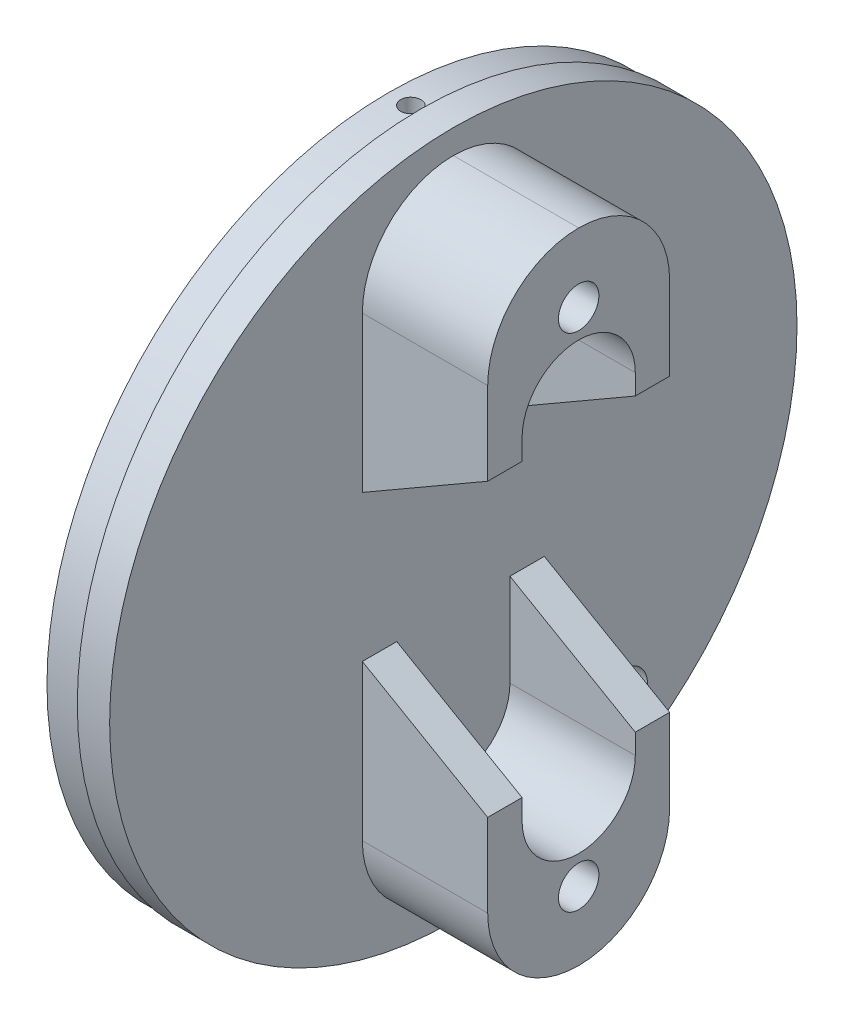
from build123d import *

# Parameters (mm, degrees)
ESQUISSE1_W                         = 32.5
ESQUISSE1_H                         = 42.5
ESQUISSE2_W                         = 9
ESQUISSE2_H                         = 58.5
CONG_R2_R                           = 2
ESQUISSE3_W                         = 4
ESQUISSE3_H                         = 0.25
D_GROSSISEMENT_OUTLINE_R            = 42.5
D_GROSSISEMENT_OUTLINE_W            = 22.5
D_GROSSISEMENT_OUTLINE_H            = 79
D_GROSSISEMENT_DEPTH                = 15.5
FINITION_EXT_R                      = 11.25
USINAGE_EN_V_DEPTH                  = 63.461988441
USINAGE_EN_V_DEPTH_BACK             = 63.461988441
RAINURE_INT_DEPTH                   = 63.461988441
ESQUISSE10_W                        = 2.5
ESQUISSE10_H                        = 15.5
TROU_TARAUD_M61_AT_2_COUNT          = 2
TROU_TARAUD_M61_AT_2_PITCH          = 62
TROU_TARAUD_M41_D                   = 3.3
DIAM_TRE_DU_PER_AGE_6_0_6_1_D       = 6
DIAM_TRE_DU_PER_AGE_2_5_2_5_1_D     = 2.5
DIAM_TRE_DU_PER_AGE_2_5_2_5_1_DEPTH = 3
DIAM_TRE_DU_PER_AGE_2_5_2_5_1_TIP   = 0.751075774


# Read off the part's stored shape, not the designer's step: Dégrossisement
with BuildPart() as part:
    # Esquisse1 → Brut (revolve)
    with BuildSketch(Plane.XY, mode=Mode.PRIVATE) as brut_sk:
        with Locations((-0.75, 21.25)):
            Rectangle(ESQUISSE1_W, ESQUISSE1_H)
    revolve(brut_sk.sketch.rotate(Axis((-714.885574261, 0, 0), (1, 0, 0)), 90), axis=Axis((-714.885574261, 0, 0), (1, 0, 0)))

    # Esquisse2 → Pion désaxer (revolve, cut)
    with BuildSketch(Plane.XY, mode=Mode.PRIVATE) as pion_d_saxer_sk:
        with Locations((-12.5, -13.25)):
            Rectangle(ESQUISSE2_W, ESQUISSE2_H)
    revolve(pion_d_saxer_sk.sketch.rotate(Axis((-1017, 20.5, 0), (1, 0, 0)), 270), axis=Axis((-1017, 20.5, 0), (1, 0, 0)), mode=Mode.SUBTRACT)

    # Congé R2
    cong_r2_edges = [part.edges().sort_by_distance(p)[0] for p in [
        (-8, 20.5, -4.5),
    ]]
    fillet(cong_r2_edges, radius=CONG_R2_R)

    # Esquisse3 → Enlèv. Ø83d9 (revolve, cut)
    with BuildSketch(Plane.XY, mode=Mode.PRIVATE) as enl_v_83d9_sk:
        with Locations((-6, 42.375)):
            Rectangle(ESQUISSE3_W, ESQUISSE3_H)
    revolve(enl_v_83d9_sk.sketch.rotate(Axis((-1000, 0, 0), (1, 0, 0)), 90), axis=Axis((-1000, 0, 0), (1, 0, 0)), mode=Mode.SUBTRACT)

    # Dégrossisement outline → Dégrossisement (cut)
    with BuildSketch(Plane(origin=(0, 0, 0), x_dir=(0, 0, -1), z_dir=(1, 0, 0))):
        Circle(D_GROSSISEMENT_OUTLINE_R)
        Rectangle(D_GROSSISEMENT_OUTLINE_W, D_GROSSISEMENT_OUTLINE_H, mode=Mode.SUBTRACT)
    extrude(amount=D_GROSSISEMENT_DEPTH, mode=Mode.SUBTRACT)

    # Finition ext.
    finition_ext_edges = [part.edges().sort_by_distance(p)[0] for p in [
        (7.75, -39.5, -11.25),
        (7.75, -39.5, 11.25),
        (7.75, 39.5, -11.25),
        (7.75, 39.5, 11.25),
    ]]
    fillet(finition_ext_edges, radius=FINITION_EXT_R - 0.0001)  # a hair under: the kernel refuses the full size

    # Esquisse5 → Usinage en V (cut, two sides: drawn at the far end of the back side and taken through both)
    with BuildSketch(Plane.XY.offset(-USINAGE_EN_V_DEPTH_BACK)):
        Polygon((0, -9.05), (0, 9.05), (15.5, 17.998929172), (15.5, -17.998929172), align=None)
    extrude(amount=USINAGE_EN_V_DEPTH + USINAGE_EN_V_DEPTH_BACK, mode=Mode.SUBTRACT)

    # Esquisse6 → Rainure Int. (cut, through all)
    with BuildSketch(Plane(origin=(0, 0, 0), x_dir=(0, 0, -1), z_dir=(1, 0, 0))):
        with BuildLine():
            Line((7, 20.5), (7, -20.5))
            ThreePointArc((7, -20.5), (0, -27.5), (-7, -20.5))
            Line((-7, -20.5), (-7, 20.5))
            ThreePointArc((-7, 20.5), (0, 27.5), (7, 20.5))
        make_face()
    extrude(amount=RAINURE_INT_DEPTH, mode=Mode.SUBTRACT)

    # Esquisse10 → Trou taraudé M61 (revolve, cut)
    with BuildSketch(Plane.ZX.offset(31)):
        with Locations((1.25, 7.75)):
            Rectangle(ESQUISSE10_W, ESQUISSE10_H)
    trou_taraud_m61 = revolve(axis=Axis((-6.35, 31, 0), (1, 0, 0)), mode=Mode.SUBTRACT)

    # Trou taraudé M61 at 2: Trou taraudé M61 ×2
    with Locations(*[(0, -i * TROU_TARAUD_M61_AT_2_PITCH, 0) for i in range(1, TROU_TARAUD_M61_AT_2_COUNT)]):
        add(trou_taraud_m61, mode=Mode.SUBTRACT)

    # Trou taraudé M41 (through all)
    with Locations(Plane.ZY.offset(17)):
        with Locations((0, 20.5)):
            Hole(TROU_TARAUD_M41_D / 2)

    # Diamètre du perçage Ø6.0 (6)1 (through all)
    with Locations(Plane.ZY.offset(8)):
        with Locations((-21, -29)):
            Hole(DIAM_TRE_DU_PER_AGE_6_0_6_1_D / 2)

    # Diamètre du perçage Ø2.5 (2.5)1
    with Locations(Plane(origin=(-5.25, 42.25, 0), x_dir=(0, 0, 1), z_dir=(0, 1, 0))):
        with Locations((0, 0)):
            Hole(DIAM_TRE_DU_PER_AGE_2_5_2_5_1_D / 2, depth=DIAM_TRE_DU_PER_AGE_2_5_2_5_1_DEPTH)
            with Locations((0, 0, -(DIAM_TRE_DU_PER_AGE_2_5_2_5_1_DEPTH + DIAM_TRE_DU_PER_AGE_2_5_2_5_1_TIP / 2))):  # 118° drill point
                Cone(0, DIAM_TRE_DU_PER_AGE_2_5_2_5_1_D / 2, DIAM_TRE_DU_PER_AGE_2_5_2_5_1_TIP, mode=Mode.SUBTRACT)


solid = part.part
